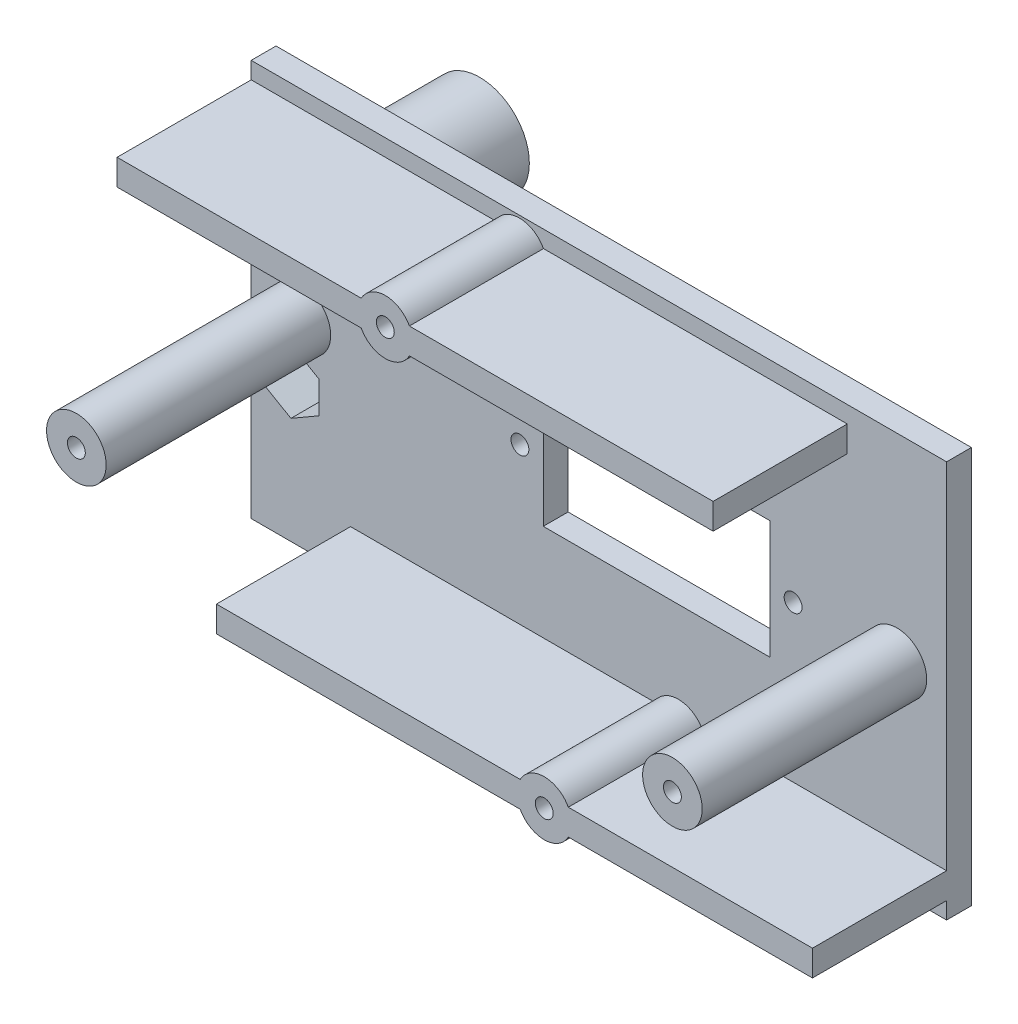
from build123d import *

# Parameters (mm, degrees)
BOSS_EXTRUDE1_START     = -2.5
SKETCH1_W               = 70
SKETCH1_H               = 39.95
BOSS_EXTRUDE1_DEPTH     = 2.5
SKETCH2_W               = 60
SKETCH2_H               = 2.6
BOSS_EXTRUDE2_DEPTH     = 13.5
SKETCH3_W               = 60
SKETCH3_H               = 2.6
BOSS_EXTRUDE3_DEPTH     = 13.5
SKETCH4_R               = 2.75
BOSS_EXTRUDE4_DEPTH     = 13.5
BOSS_EXTRUDE5_START     = -19
SKETCH5_R               = 5
BOSS_EXTRUDE5_DEPTH     = 16.5
SKETCH6_R               = 3
BOSS_EXTRUDE6_DEPTH     = 22.6
CUT_EXTRUDE1_START      = 14.6
SKETCH7_R               = 0.9
CUT_EXTRUDE1_DEPTH      = 8.1
CUT_EXTRUDE2_DEPTH      = 47.965525921
CUT_EXTRUDE2_DEPTH_BACK = 47.965525921
SKETCH8_W               = 22.8
SKETCH8_H               = 11.9
CUT_EXTRUDE3_DEPTH      = 47.965525921
CUT_EXTRUDE3_DEPTH_BACK = 47.965525921
SKETCH9_R               = 0.9
CUT_EXTRUDE4_DEPTH      = 47.965525921
CUT_EXTRUDE4_DEPTH_BACK = 47.965525921
SKETCH10_R              = 0.9
CUT_EXTRUDE5_DEPTH      = 47.965525921
CUT_EXTRUDE5_DEPTH_BACK = 47.965525921
SKETCH11_R              = 1.725
CUT_EXTRUDE6_START      = -4.2
CUT_EXTRUDE6_DEPTH      = 4.2


with BuildPart() as part:
    # Sketch1 → Boss-Extrude1 (new body)
    with BuildSketch(Plane.XY.offset(BOSS_EXTRUDE1_START)):
        Rectangle(SKETCH1_W, SKETCH1_H)
    extrude(amount=BOSS_EXTRUDE1_DEPTH)

    # Sketch2 → Boss-Extrude2 (add)
    with BuildSketch(Plane.XY):
        with Locations((-5, 16.975)):
            Rectangle(SKETCH2_W, SKETCH2_H)
    extrude(amount=BOSS_EXTRUDE2_DEPTH)

    # Sketch3 → Boss-Extrude3 (add)
    with BuildSketch(Plane.XY):
        with Locations((5, -16.975)):
            Rectangle(SKETCH3_W, SKETCH3_H)
    extrude(amount=BOSS_EXTRUDE3_DEPTH)

    # Sketch4 → Boss-Extrude4 (add)
    with BuildSketch(Plane.XY):
        with Locations((-8, 16.975)):
            Circle(SKETCH4_R)
        with Locations((8, -16.975)):
            Circle(SKETCH4_R)
    extrude(amount=BOSS_EXTRUDE4_DEPTH)

    # Sketch5 → Boss-Extrude5 (add)
    with BuildSketch(Plane.XY.offset(BOSS_EXTRUDE5_START)):
        with Locations((-31, 6)):
            Circle(SKETCH5_R)
        with Locations((-31, -6)):
            Circle(SKETCH5_R)
    extrude(amount=BOSS_EXTRUDE5_DEPTH)

    # Sketch6 → Boss-Extrude6 (add)
    with BuildSketch(Plane.XY):
        with Locations((30, 0)):
            Circle(SKETCH6_R)
        with Locations((-30, 0)):
            Circle(SKETCH6_R)
    extrude(amount=BOSS_EXTRUDE6_DEPTH)

    # Sketch7 → Cut-Extrude1 (cut)
    with BuildSketch(Plane.XY.offset(CUT_EXTRUDE1_START)):
        with Locations((30, 0)):
            Circle(SKETCH7_R)
        with Locations((-30, 0)):
            Circle(SKETCH7_R)
    extrude(amount=CUT_EXTRUDE1_DEPTH, mode=Mode.SUBTRACT)

    # Sketch8 → Cut-Extrude2 (cut, two sides: drawn at the far end of the back side and taken through both)
    with BuildSketch(Plane.XY.offset(-CUT_EXTRUDE2_DEPTH_BACK)):
        with Locations((5.8, 0)):
            Rectangle(SKETCH8_W, SKETCH8_H)
    extrude(amount=CUT_EXTRUDE2_DEPTH + CUT_EXTRUDE2_DEPTH_BACK, mode=Mode.SUBTRACT)

    # Sketch9 → Cut-Extrude3 (cut, two sides: drawn at the far end of the back side and taken through both)
    with BuildSketch(Plane.XY.offset(-CUT_EXTRUDE3_DEPTH_BACK)):
        with Locations((-7.95, 0)):
            Circle(SKETCH9_R)
        with Locations((19.55, 0)):
            Circle(SKETCH9_R)
    extrude(amount=CUT_EXTRUDE3_DEPTH + CUT_EXTRUDE3_DEPTH_BACK, mode=Mode.SUBTRACT)

    # Sketch10 → Cut-Extrude4 (cut, two sides: drawn at the far end of the back side and taken through both)
    with BuildSketch(Plane.XY.offset(-CUT_EXTRUDE4_DEPTH_BACK)):
        with Locations((-8, 16.975)):
            Circle(SKETCH10_R)
        with Locations((8, -16.975)):
            Circle(SKETCH10_R)
    extrude(amount=CUT_EXTRUDE4_DEPTH + CUT_EXTRUDE4_DEPTH_BACK, mode=Mode.SUBTRACT)

    # Sketch11 → Cut-Extrude5 (cut, two sides: drawn at the far end of the back side and taken through both)
    with BuildSketch(Plane.XY.offset(-CUT_EXTRUDE5_DEPTH_BACK)):
        with Locations((-31, 6)):
            Circle(SKETCH11_R)
        with Locations((-31, -6)):
            Circle(SKETCH11_R)
    extrude(amount=CUT_EXTRUDE5_DEPTH + CUT_EXTRUDE5_DEPTH_BACK, mode=Mode.SUBTRACT)

    # Sketch12 → Cut-Extrude6 (cut)
    with BuildSketch(Plane.XY.offset(CUT_EXTRUDE6_START)):
        Polygon((-28.2, 7.616580754), (-31, 9.233161507), (-33.8, 7.616580754), (-33.8, 4.383419246), (-31, 2.766838493), (-28.2, 4.383419246), align=None)
        Polygon((-28.2, -4.383419246), (-31, -2.766838493), (-33.8, -4.383419246), (-33.8, -7.616580754), (-31, -9.233161507), (-28.2, -7.616580754), align=None)
    extrude(amount=CUT_EXTRUDE6_DEPTH, mode=Mode.SUBTRACT)


solid = part.part
